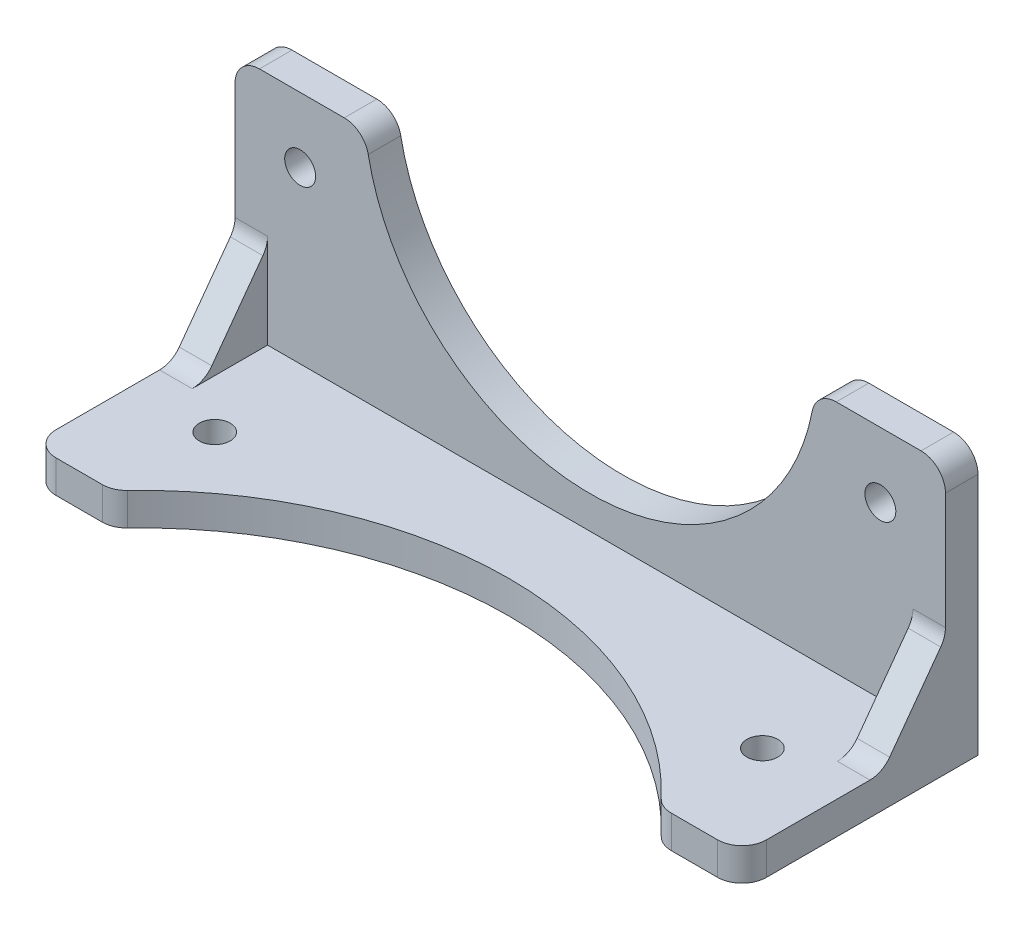
from build123d import *

# Parameters (mm, degrees)
SKETCH1_R      = 1.9
EXTRUDE1_DEPTH = 4
SKETCH2_R      = 1.9
EXTRUDE2_DEPTH = 4
EXTRUDE3_DEPTH = 4
FILLET1_R      = 3


with BuildPart() as part:
    # Sketch1 → Extrude1 (new body)
    with BuildSketch(Plane.XY):
        with BuildLine():
            Line((-43.65, 4.783810266), (-27.65, 4.783810266))
            ThreePointArc((-27.65, 4.783810266), (0, -20.116189734), (27.65, 4.783810266))
            Line((27.65, 4.783810266), (43.65, 4.783810266))
            Line((43.65, 4.783810266), (43.65, -28.116189734))
            Line((43.65, -28.116189734), (-43.65, -28.116189734))
            Line((-43.65, -28.116189734), (-43.65, 4.783810266))
        make_face()
        with Locations((-35.65, -3.216189734)):
            Circle(SKETCH1_R, mode=Mode.SUBTRACT)
        with Locations((35.65, -3.216189734)):
            Circle(SKETCH1_R, mode=Mode.SUBTRACT)
    extrude(amount=EXTRUDE1_DEPTH)



with BuildPart() as body_2:
    # Sketch2 → Extrude2 (new body)
    with BuildSketch(Plane.XZ.offset(28.116189734)):
        with BuildLine():
            Line((-33.65, 29), (-43.65, 29))
            Line((-43.65, 29), (-43.65, 4))
            Line((-43.65, 4), (43.65, 4))
            Line((43.65, 4), (43.65, 29))
            Line((43.65, 29), (33.65, 29))
            ThreePointArc((33.65, 29), (0, 14), (-33.65, 29))
        make_face()
        with Locations((-33.65, 16.5)):
            Circle(SKETCH2_R, mode=Mode.SUBTRACT)
        with Locations((33.65, 16.5)):
            Circle(SKETCH2_R, mode=Mode.SUBTRACT)
    extrude(amount=-EXTRUDE2_DEPTH)


with BuildPart() as part_1:
    add(part.part)

    add(body_2.part)  # Extrude3 merges body 2
    # Sketch3 → Extrude3 (add)
    with BuildSketch(Plane(origin=(43.65, 0, 0), x_dir=(0, 0, -1), z_dir=(1, 0, 0))):
        Polygon((-4, -24.116189734), (-11.756042517, -24.116189734), (-4, -13.510964822), align=None)
    extrude3 = extrude(amount=-EXTRUDE3_DEPTH)

    # Mirror1: Extrude3 across plane
    add(extrude3.mirror(Plane(origin=(0, 0, 0), x_dir=(0, 0, 1), z_dir=(1, 0, 0))))

    # Fillet1
    fillet1_edges = [part_1.edges().sort_by_distance(p)[0] for p in [
        (43.65, -26.116189734, 29),
        (33.65, -26.116189734, 29),
        (-33.65, -26.116189734, 29),
        (-43.65, -26.116189734, 29),
        (-41.65, -13.510964822, 4),
        (-41.65, -24.116189734, 11.756042517),
        (41.65, -24.116189734, 11.756042517),
        (41.65, -13.510964822, 4),
        (43.65, 4.783810266, 2),
        (27.65, 4.783810266, 2),
        (-27.65, 4.783810266, 2),
        (-43.65, 4.783810266, 2),
    ]]
    fillet(fillet1_edges, radius=FILLET1_R)


solid = part_1.part
